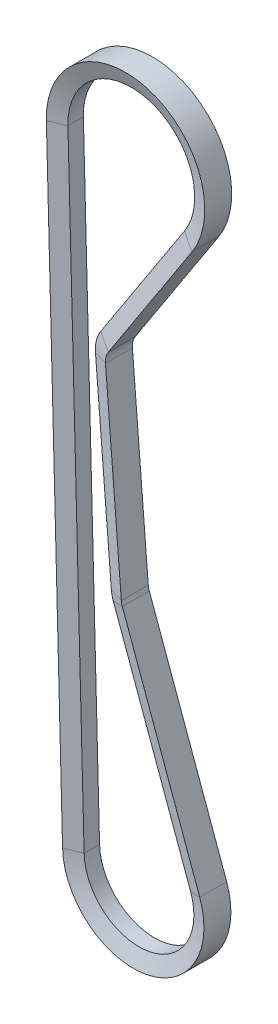
from build123d import *


with BuildPart() as part:
    # Sweep1: sweep along a path in Sketch2
    with BuildLine(Plane.XY) as sweep1_path:
        Line((-24.99154886, -0.649988923), (-30.710919549, 219.25519246))
        ThreePointArc((-30.710919549, 219.25519246), (4.894316869, 246.927870033), (20.748824179, 204.712416199))
        Line((20.748824179, 204.712416199), (-8.818729708, 159.270871262))
        ThreePointArc((-8.818729708, 159.270871262), (-9.651480053, 157.368328454), (-9.825829011, 155.29884912))
        Line((-9.825829011, 155.29884912), (-4.216667792, 85.523944531))
        ThreePointArc((-4.216667792, 85.523944531), (-4.09188228, 84.682583917), (-3.85577144, 83.865448202))
        Line((-3.85577144, 83.865448202), (23.498757001, 8.532784972))
        ThreePointArc((23.498757001, 8.532784972), (4.651660025, -24.563429301), (-24.99154886, -0.649988923))
    # Sketch3 → Sweep1 (sweep)
    with BuildSketch(Plane(origin=(23.498757001, 8.532784972, 0), x_dir=(-0.9399502800580037, -0.3413113988997153, 0), z_dir=(0.3413113988997153, -0.9399502800580037, 0))):
        Polygon((0, -4.7625), (0, 4.7625), (5.588, 2.728634331), (5.588, -2.728634331), align=None)
    sweep(path=sweep1_path.line)


solid = part.part
